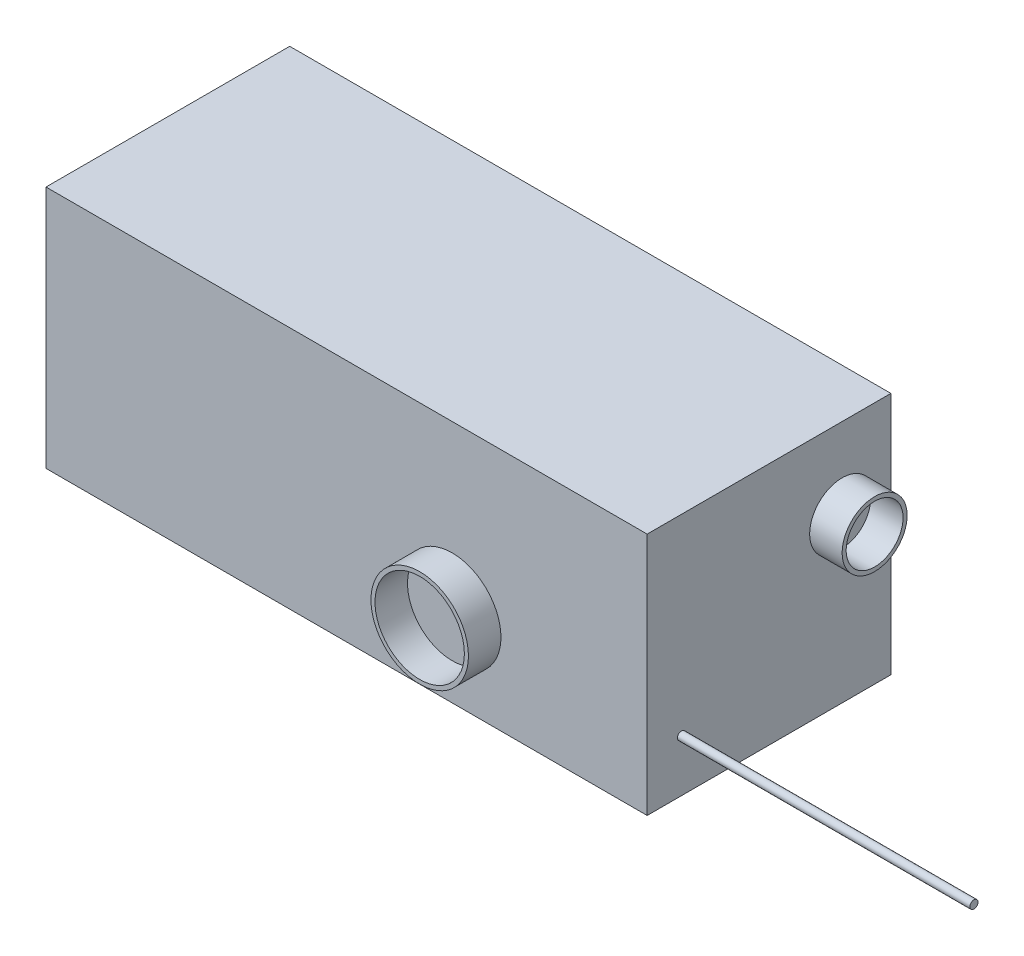
from build123d import *

# Parameters (mm, degrees)
SKETCH1_W           = 939.8
SKETCH1_H           = 381
BOSS_EXTRUDE1_DEPTH = 381
SKETCH2_R           = 76.2
SKETCH2_R_2         = 69.85
BOSS_EXTRUDE2_DEPTH = 50.8
SKETCH3_R           = 50.8
SKETCH3_R_2         = 44.45
BOSS_EXTRUDE3_DEPTH = 50.8
SKETCH4_R           = 6.35
BOSS_EXTRUDE4_DEPTH = 457.2
SKETCH5_R           = 50.8
SKETCH5_R_2         = 44.45
BOSS_EXTRUDE5_DEPTH = 50.8
SKETCH6_R           = 76.2
SKETCH6_R_2         = 69.85
BOSS_EXTRUDE6_DEPTH = 50.8


with BuildPart() as part:
    # Sketch1 → Boss-Extrude1 (new body)
    with BuildSketch(Plane(origin=(0, 0, 0), x_dir=(1, 0, 0), z_dir=(0, 1, 0))):
        Rectangle(SKETCH1_W, SKETCH1_H)
    extrude(amount=BOSS_EXTRUDE1_DEPTH)

    # Sketch2 → Boss-Extrude2 (add)
    with BuildSketch(Plane.XY.offset(190.5)):
        with Locations((165.1, 127)):
            Circle(SKETCH2_R)
        with Locations((165.1, 127)):
            Circle(SKETCH2_R_2, mode=Mode.SUBTRACT)
    extrude(amount=BOSS_EXTRUDE2_DEPTH)

    # Sketch3 → Boss-Extrude3 (add)
    with BuildSketch(Plane(origin=(469.9, 0, 0), x_dir=(0, 0, -1), z_dir=(1, 0, 0))):
        with Locations((114.3, 254)):
            Circle(SKETCH3_R)
        with Locations((114.3, 254)):
            Circle(SKETCH3_R_2, mode=Mode.SUBTRACT)
    extrude(amount=BOSS_EXTRUDE3_DEPTH)

    # Sketch4 → Boss-Extrude4 (add)
    with BuildSketch(Plane(origin=(469.9, 0, 0), x_dir=(0, 0, -1), z_dir=(1, 0, 0))):
        with Locations((-136.850125002, 81.35113945)):
            Circle(SKETCH4_R)
    extrude(amount=BOSS_EXTRUDE4_DEPTH)

    # Sketch5 → Boss-Extrude5 (add)
    with BuildSketch(Plane(origin=(0, 0, -190.5), x_dir=(-1, 0, 0), z_dir=(0, 0, -1))):
        with Locations((185.69264526, 273.888159849)):
            Circle(SKETCH5_R)
        with Locations((185.69264526, 273.888159849)):
            Circle(SKETCH5_R_2, mode=Mode.SUBTRACT)
    extrude(amount=BOSS_EXTRUDE5_DEPTH)

    # Sketch6 → Boss-Extrude6 (add)
    with BuildSketch(Plane.ZY.offset(469.9)):
        with Locations((0, 190.5)):
            Circle(SKETCH6_R)
        with Locations((0, 190.5)):
            Circle(SKETCH6_R_2, mode=Mode.SUBTRACT)
    extrude(amount=BOSS_EXTRUDE6_DEPTH)


solid = part.part
